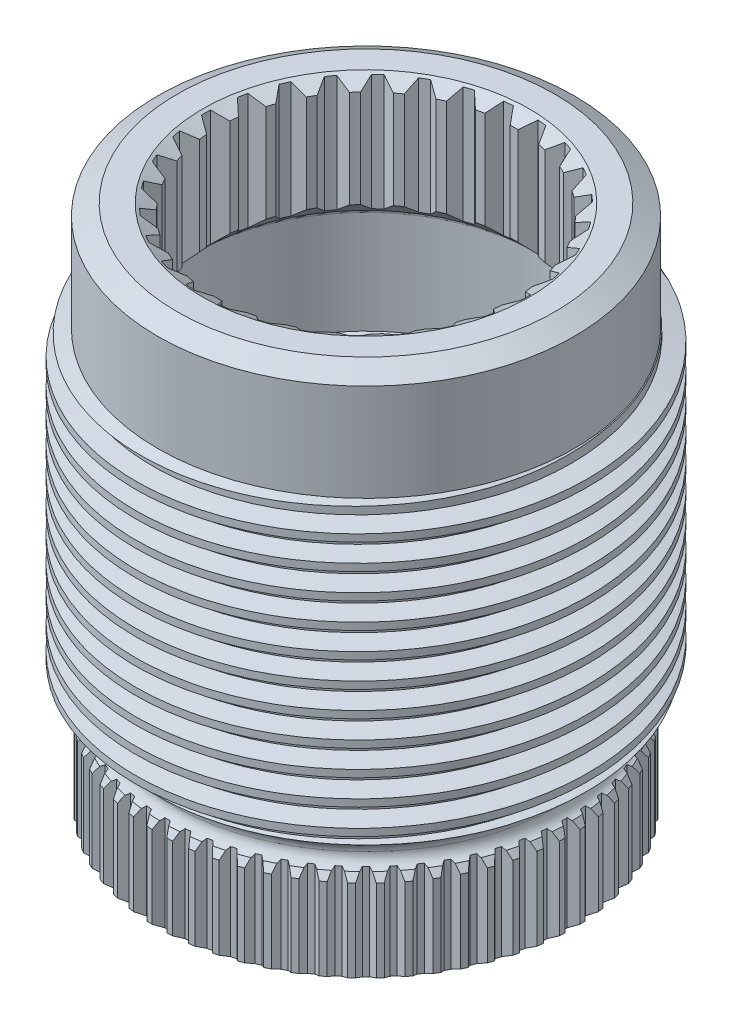
from build123d import *

# Parameters (mm, degrees)
SKETCH1_R           = 28.17114
BOSS_EXTRUDE1_DEPTH = 37.8714
SKETCH2_R           = 25.93975
BOSS_EXTRUDE2_DEPTH = 13.4874
CHAMFER1_SIZE       = 2.44475
CHAMFER1_SIZE2      = 1.411477071
SKETCH3_R           = 24.13
BOSS_EXTRUDE3_DEPTH = 3.048
SKETCH4_R           = 25.7302
BOSS_EXTRUDE4_DEPTH = 12.2682
CHAMFER2_SIZE       = 1.311023897
CHAMFER2_SIZE_2     = 2.27076
CHAMFER3_SIZE       = 2.2352
CHAMFER3_SIZE2      = 1.290493322
FILLET1_R           = 1.524
FILLET2_R           = 1.524
SKETCH8_R           = 18.4531
CUT_EXTRUDE1_DEPTH  = 66.675
SKETCH9_R           = 19.08175
CUT_EXTRUDE2_DEPTH  = 51.3334
SKETCH11_R          = 21.336
CUT_EXTRUDE3_DEPTH  = 13.5636
CHAMFER5_SIZE2      = 2.25425
CHAMFER5_SIZE       = 1.301491844
CHAMFER6_SIZE       = 1.8669
CHAMFER6_SIZE2      = 1.077855218
FILLET4_R           = 0.762
CHAMFER8_SIZE       = 1.74625
CHAMFER8_SIZE2      = 1.008197908
CHAMFER10_SIZE      = 2.1209
THREAD1_PITCH       = 3.175
THREAD3_PITCH       = 3.175
CUT_EXTRUDE4_DEPTH  = 21.844
CUT_EXTRUDE5_START  = -12.959881011
CUT_EXTRUDE5_DEPTH  = 12.959881011


with BuildPart() as part:
    # Sketch1 → Boss-Extrude1 (new body)
    with BuildSketch(Plane(origin=(0, 0, 0), x_dir=(1, 0, 0), z_dir=(0, 1, 0))):
        with Locations(Location((0, 0, 0), (0, 0, 270))):
            Circle(SKETCH1_R)
    extrude(amount=BOSS_EXTRUDE1_DEPTH)

    # Sketch2 → Boss-Extrude2 (add)
    with BuildSketch(Plane(origin=(0, 37.8714, 0), x_dir=(1, 0, 0), z_dir=(0, 1, 0))):
        with Locations(Location((0, 0, 0), (0, 0, 270))):
            Circle(SKETCH2_R)
    extrude(amount=BOSS_EXTRUDE2_DEPTH)

    # Chamfer1
    chamfer1_edges = [part.edges().sort_by_distance(p)[0] for p in [
        (0, 51.3588, -25.93975),
    ]]
    chamfer1_side = [part.faces().sort_by_distance(p)[0] for p in [
        (0, 51.3588, 0),
    ]]
    chamfer(chamfer1_edges, length=CHAMFER1_SIZE, length2=CHAMFER1_SIZE2, reference=chamfer1_side[0])

    # Sketch3 → Boss-Extrude3 (add)
    with BuildSketch(Plane.XZ):
        with Locations(Location((0, 0, 0), (0, 0, 90))):
            Circle(SKETCH3_R)
    extrude(amount=BOSS_EXTRUDE3_DEPTH)

    # Sketch4 → Boss-Extrude4 (add)
    with BuildSketch(Plane.XZ.offset(3.048)):
        with Locations(Location((0, 0, 0), (0, 0, 270))):
            Circle(SKETCH4_R)
    extrude(amount=BOSS_EXTRUDE4_DEPTH)

    # Chamfer2
    # the kernel refuses this chamfer: 2.27076, 1.311023897 mm, written as the material it takes off along each edge
    with BuildSketch(Plane(origin=(0, 37.8714, 0), x_dir=(0, 0, 1), z_dir=(-1, 0, 0))) as chamfer2_piece_1_section:
        Polygon((28.17114, -CHAMFER2_SIZE), (28.17114 - CHAMFER2_SIZE_2, 0), (28.17114, 0), align=None)
    chamfer2_piece_1 = revolve(axis=Axis((0, 37.8714, 0), (0, 1, 0)), mode=Mode.PRIVATE)
    chamfer2_piece_1 = chamfer2_piece_1 - Plane(origin=(0, 37.8714, 0), x_dir=(0, 0, 1), z_dir=(0, -1, 0)) * Cylinder(25.93975, 113, mode=Mode.PRIVATE)
    add(chamfer2_piece_1, mode=Mode.SUBTRACT)

    # Chamfer3
    chamfer3_edges = [part.edges().sort_by_distance(p)[0] for p in [
        (0, -15.3162, 25.7302),
    ]]
    chamfer3_side = [part.faces().sort_by_distance(p)[0] for p in [
        (0, -15.3162, 0),
    ]]
    chamfer(chamfer3_edges, length=CHAMFER3_SIZE, length2=CHAMFER3_SIZE2, reference=chamfer3_side[0])

    # Fillet1
    fillet1_edges = [part.edges().sort_by_distance(p)[0] for p in [
        (0, -3.048, -24.13),
    ]]
    fillet(fillet1_edges, radius=FILLET1_R)

    # Fillet2
    fillet2_edges = [part.edges().sort_by_distance(p)[0] for p in [
        (0, 0, -24.13),
    ]]
    fillet(fillet2_edges, radius=FILLET2_R - 0.0001)  # a hair under: the kernel refuses the full size

    # Chamfer4: read off the stored shape, not the designer's step
    # Chamfer4 outline → Chamfer4 (revolve, cut)
    with BuildSketch(Plane.XY):
        Polygon((25.654, -2.95893919), (25.140652632, -2.95893919), (25.7302, -3.795987051), (25.7302, -3.048), (25.654, -3.048), align=None)
    revolve(axis=Axis((0, 0, 0), (0, 1, 0)), mode=Mode.SUBTRACT)

    # Sketch8 → Cut-Extrude1 (cut)
    with BuildSketch(Plane(origin=(0, 51.3588, 0), x_dir=(1, 0, 0), z_dir=(0, 1, 0))):
        with Locations(Location((0, 0, 0), (0, 0, 270))):
            Circle(SKETCH8_R)
    extrude(amount=-CUT_EXTRUDE1_DEPTH, mode=Mode.SUBTRACT)

    # Sketch9 → Cut-Extrude2 (cut)
    with BuildSketch(Plane.XZ.offset(15.3162)):
        with Locations(Location((0, 0, 0), (0, 0, 270))):
            Circle(SKETCH9_R)
    extrude(amount=-CUT_EXTRUDE2_DEPTH, mode=Mode.SUBTRACT)

    # Sketch11 → Cut-Extrude3 (cut)
    with BuildSketch(Plane.XZ.offset(-36.0172)):
        with Locations(Location((0, 0, 0), (0, 0, 90))):
            Circle(SKETCH11_R)
    extrude(amount=CUT_EXTRUDE3_DEPTH, mode=Mode.SUBTRACT)

    # Chamfer5
    chamfer5_edges = [part.edges().sort_by_distance(p)[0] for p in [
        (0, 22.4536, 19.08175),
    ]]
    chamfer5_side = [part.faces().sort_by_distance(p)[0] for p in [
        (0, 22.427570163, 19.08175),
    ]]
    chamfer(chamfer5_edges, length=CHAMFER5_SIZE - 0.0001, length2=CHAMFER5_SIZE2 - 0.0001, reference=chamfer5_side[0])  # a hair under: the kernel refuses the full size

    # Chamfer6
    chamfer6_edges = [part.edges().sort_by_distance(p)[0] for p in [
        (0, 51.3588, -18.4531),
    ]]
    chamfer6_side = [part.faces().sort_by_distance(p)[0] for p in [
        (0, 51.3588, -22.830461047),
    ]]
    chamfer(chamfer6_edges, length=CHAMFER6_SIZE, length2=CHAMFER6_SIZE2, reference=chamfer6_side[0])

    # Fillet4
    fillet4_edges = [part.edges().sort_by_distance(p)[0] for p in [
        (0, 36.0172, -21.336),
    ]]
    fillet(fillet4_edges, radius=FILLET4_R)

    # Chamfer8
    chamfer8_edges = [part.edges().sort_by_distance(p)[0] for p in [
        (0, -15.3162, 19.08175),
    ]]
    chamfer8_side = [part.faces().sort_by_distance(p)[0] for p in [
        (0, -15.3162, 22.830461047),
    ]]
    chamfer(chamfer8_edges, length=CHAMFER8_SIZE, length2=CHAMFER8_SIZE2, reference=chamfer8_side[0])

    # Chamfer9: read off the stored shape, not the designer's step
    # Chamfer9 outline → Chamfer9 (revolve, cut)
    with BuildSketch(Plane.XY):
        Polygon((25.039915621, -0.129196654), (25.654, -0.129196654), (25.654, 0), (28.17114, 0), (28.17114, 2.026967556), align=None)
    revolve(axis=Axis((0, 0, 0), (0, 1, 0)), mode=Mode.SUBTRACT)

    # Chamfer10
    chamfer10_edges = [part.edges().sort_by_distance(p)[0] for p in [
        (0, 36.0172, -18.4531),
    ]]
    chamfer(chamfer10_edges, length=CHAMFER10_SIZE - 0.0001)  # a hair under: the kernel refuses the full size

    # Thread1: arcs per turn and ends read off the stored shape
    # Thread1: the profile of Thread Profile1 profile screwed along a right-hand helix through 12.716664 turns, 12 arcs to a turn; built about Z, then put on its axis
    thread1_z = Axis((0, 0, 0), (0, 0, 1))
    thread1_corners = [(28.17144, 0, -7.7585e-05), (28.17144, 0, 2.275431432), (26.0477, 0, 1.726194924), (26.0477, 0, 0.549158924)]
    with BuildLine(mode=Mode.PRIVATE) as thread1_profile:
        Line(thread1_corners[0], thread1_corners[1])
        Line(thread1_corners[1], thread1_corners[2])
        Line(thread1_corners[2], thread1_corners[3])
        Line(thread1_corners[3], thread1_corners[0])
    thread1_cap = Face(thread1_profile.wire())
    thread1_turn_angles = [0, 15, 30, 45, 60, 75, 90, 105, 120, 135, 150, 165, 180, 195, 210, 225, 240, 255, 270, 285, 300, 315, 330, 345, 360]
    thread1_turn_weights = [1, 0.9659258262890683, 1, 0.9659258262890683, 1, 0.9659258262890683, 1, 0.9659258262890683, 1, 0.9659258262890683, 1, 0.9659258262890683, 1, 0.9659258262890683, 1, 0.9659258262890683, 1, 0.9659258262890683, 1, 0.9659258262890683, 1, 0.9659258262890683, 1, 0.9659258262890683, 1]
    thread1_turn_rails = [Edge.make_bspline([Vector(p[0], p[1], 0).rotate(thread1_z, thread1_turn_angles[k]) / thread1_turn_weights[k] + Vector(0, 0, p[2] + THREAD1_PITCH * thread1_turn_angles[k] / 360) for k in range(25)], [0, 0, 0, 1, 1, 2, 2, 3, 3, 4, 4, 5, 5, 6, 6, 7, 7, 8, 8, 9, 9, 10, 10, 11, 11, 12, 12, 12], 2, thread1_turn_weights) for p in thread1_corners]
    thread1_turn_sides = [Face.make_surface_from_curves(thread1_turn_rails[p[0]], thread1_turn_rails[p[1]]) for p in [(0, 1), (1, 2), (2, 3), (3, 0)]]
    thread1_last_angles = [4320, 4335, 4350, 4365, 4380, 4395, 4410, 4425, 4440, 4455, 4470, 4485, 4500, 4515, 4530, 4545, 4560, 4568.9995, 4577.999]
    thread1_last_weights = [1, 0.9659258262890683, 1, 0.9659258262890683, 1, 0.9659258262890683, 1, 0.9659258262890683, 1, 0.9659258262890683, 1, 0.9659258262890683, 1, 0.9659258262890683, 1, 0.9659258262890683, 1, 0.9876897057057689, 1]
    thread1_last_rails = [Edge.make_bspline([Vector(p[0], p[1], 0).rotate(thread1_z, thread1_last_angles[k]) / thread1_last_weights[k] + Vector(0, 0, p[2] + THREAD1_PITCH * thread1_last_angles[k] / 360) for k in range(19)], [0, 0, 0, 1, 1, 2, 2, 3, 3, 4, 4, 5, 5, 6, 6, 7, 7, 8, 8, 9, 9, 9], 2, thread1_last_weights) for p in thread1_corners]
    thread1_last_sides = [Face.make_surface_from_curves(thread1_last_rails[p[0]], thread1_last_rails[p[1]]) for p in [(0, 1), (1, 2), (2, 3), (3, 0)]]
    thread1 = Plane(origin=(0, 39.862376103, 0), x_dir=(-1, 0, 0), z_dir=(0, -1, 0)) * Solid(Shell([*[p.moved(Location((0, 0, THREAD1_PITCH * i))) for i in range(12) for p in thread1_turn_sides], *thread1_last_sides, thread1_cap, thread1_cap.rotate(thread1_z, 4577.999).moved(Location((0, 0, THREAD1_PITCH * 4577.999 / 360)))]))
    add(thread1, mode=Mode.SUBTRACT)

    # Thread3: arcs per turn and ends read off the stored shape
    # Thread3: the profile of Thread Profile5 profile screwed along a right-hand helix through 11.483499 turns, 12 arcs to a turn; built about Z, then put on its axis
    thread3_z = Axis((0, 0, 0), (0, 0, 1))
    thread3_corners = [(19.08145, 0, -0.000173205), (21.14423, 0, 1.190773384), (21.14423, 0, 1.587013384), (19.08145, 0, 2.777959972)]
    with BuildLine(mode=Mode.PRIVATE) as thread3_profile:
        Line(thread3_corners[0], thread3_corners[1])
        Line(thread3_corners[1], thread3_corners[2])
        Line(thread3_corners[2], thread3_corners[3])
        Line(thread3_corners[3], thread3_corners[0])
    thread3_cap = Face(thread3_profile.wire())
    thread3_turn_angles = [0, 15, 30, 45, 60, 75, 90, 105, 120, 135, 150, 165, 180, 195, 210, 225, 240, 255, 270, 285, 300, 315, 330, 345, 360]
    thread3_turn_weights = [1, 0.9659258262890683, 1, 0.9659258262890683, 1, 0.9659258262890683, 1, 0.9659258262890683, 1, 0.9659258262890683, 1, 0.9659258262890683, 1, 0.9659258262890683, 1, 0.9659258262890683, 1, 0.9659258262890683, 1, 0.9659258262890683, 1, 0.9659258262890683, 1, 0.9659258262890683, 1]
    thread3_turn_rails = [Edge.make_bspline([Vector(p[0], p[1], 0).rotate(thread3_z, thread3_turn_angles[k]) / thread3_turn_weights[k] + Vector(0, 0, p[2] + THREAD3_PITCH * thread3_turn_angles[k] / 360) for k in range(25)], [0, 0, 0, 1, 1, 2, 2, 3, 3, 4, 4, 5, 5, 6, 6, 7, 7, 8, 8, 9, 9, 10, 10, 11, 11, 12, 12, 12], 2, thread3_turn_weights) for p in thread3_corners]
    thread3_turn_sides = [Face.make_surface_from_curves(thread3_turn_rails[p[0]], thread3_turn_rails[p[1]]) for p in [(0, 1), (1, 2), (2, 3), (3, 0)]]
    thread3_last_angles = [3960, 3975, 3990, 4005, 4020, 4035, 4050, 4065, 4080, 4095, 4110, 4122.029872334, 4134.059744667]
    thread3_last_weights = [1, 0.9659258262890683, 1, 0.9659258262890683, 1, 0.9659258262890683, 1, 0.9659258262890683, 1, 0.9659258262890683, 1, 0.9780390687569304, 1]
    thread3_last_rails = [Edge.make_bspline([Vector(p[0], p[1], 0).rotate(thread3_z, thread3_last_angles[k]) / thread3_last_weights[k] + Vector(0, 0, p[2] + THREAD3_PITCH * thread3_last_angles[k] / 360) for k in range(13)], [0, 0, 0, 1, 1, 2, 2, 3, 3, 4, 4, 5, 5, 6, 6, 6], 2, thread3_last_weights) for p in thread3_corners]
    thread3_last_sides = [Face.make_surface_from_curves(thread3_last_rails[p[0]], thread3_last_rails[p[1]]) for p in [(0, 1), (1, 2), (2, 3), (3, 0)]]
    thread3 = Plane(origin=(0, 22.152108156, 0), x_dir=(-1, 0, 0), z_dir=(0, -1, 0)) * Solid(Shell([*[p.moved(Location((0, 0, THREAD3_PITCH * i))) for i in range(11) for p in thread3_turn_sides], *thread3_last_sides, thread3_cap, thread3_cap.rotate(thread3_z, 4134.059744667).moved(Location((0, 0, THREAD3_PITCH * 4134.059744667 / 360)))]))
    add(thread3, mode=Mode.SUBTRACT)

    # Sketch12 → Cut-Extrude4 (cut)
    with BuildSketch(Plane(origin=(0, 51.3588, 0), x_dir=(1, 0, 0), z_dir=(0, 1, 0))):
        with BuildLine():
            Line((-19.931277354, 0.554891028), (-18.37006938, 1.456254871))
            ThreePointArc((-18.37006938, 1.456254871), (-18.4277, 0), (-18.37006938, -1.456254871))
            Line((-18.37006938, -1.456254871), (-19.931277354, -0.554891028))
            ThreePointArc((-19.931277354, -0.554891028), (-19.939, 0), (-19.931277354, 0.554891028))
        make_face()
        with BuildLine():
            Line((-19.611099455, 3.601180247), (-18.271411702, 2.394919977))
            ThreePointArc((-18.271411702, 2.394919977), (-18.025010542, 3.831334265), (-17.665866877, 5.243784394))
            Line((-17.665866877, 5.243784394), (-19.380362791, 4.686710902))
            ThreePointArc((-19.380362791, 4.686710902), (-19.503285011, 4.145551203), (-19.611099455, 3.601180247))
        make_face()
        with BuildLine():
            Line((-18.433822405, 7.599862665), (-17.374205657, 6.14142533))
            ThreePointArc((-17.374205657, 6.14142533), (-16.83454163, 7.495220838), (-16.189581221, 8.802135376))
            Line((-16.189581221, 8.802135376), (-17.982433378, 8.613699021))
            ThreePointArc((-17.982433378, 8.613699021), (-18.21518288, 8.109921926), (-18.433822405, 7.599862665))
        make_face()
        with BuildLine():
            Line((-16.450898861, 11.266394616), (-15.717663453, 9.619520926))
            ThreePointArc((-15.717663453, 9.619520926), (-14.908322467, 10.831530294), (-14.00573318, 11.975790804))
            Line((-14.00573318, 11.975790804), (-15.798585336, 12.164227159))
            ThreePointArc((-15.798585336, 12.164227159), (-16.130989851, 11.719850145), (-16.450898861, 11.266394616))
        make_face()
        with BuildLine():
            Line((-13.748992097, 14.440531061), (-13.374183935, 12.677197299))
            ThreePointArc((-13.374183935, 12.677197299), (-12.330538075, 13.6944499), (-11.209767391, 14.626046709))
            Line((-11.209767391, 14.626046709), (-12.924263305, 15.1831202))
            ThreePointArc((-12.924263305, 15.1831202), (-13.34179516, 14.817564675), (-13.748992097, 14.440531061))
        make_face()
        with BuildLine():
            Line((-10.446188403, 16.983547004), (-10.446188403, 15.180819317))
            ThreePointArc((-10.446188403, 15.180819317), (-9.21385, 15.958856333), (-7.923880977, 16.637074188))
            Line((-7.923880977, 16.637074188), (-9.485088951, 17.538438032))
            ThreePointArc((-9.485088951, 17.538438032), (-9.9695, 17.267680526), (-10.446188403, 16.983547004))
        make_face()
        with BuildLine():
            Line((-6.68683615, 18.784300448), (-7.061644311, 17.020966686))
            ThreePointArc((-7.061644311, 17.020966686), (-5.694472467, 17.525784165), (-4.291682942, 17.920981692))
            Line((-4.291682942, 17.920981692), (-5.631370694, 19.127241963))
            ThreePointArc((-5.631370694, 19.127241963), (-6.161489851, 18.963115878), (-6.68683615, 18.784300448))
        make_face()
        with BuildLine():
            Line((-2.635237069, 19.764089824), (-3.368472477, 18.117216134))
            ThreePointArc((-3.368472477, 18.117216134), (-1.926219163, 18.326751131), (-0.471917768, 18.421656302))
            Line((-0.471917768, 18.421656302), (-1.531534516, 19.880093637))
            ThreePointArc((-1.531534516, 19.880093637), (-2.084193029, 19.829772072), (-2.635237069, 19.764089824))
        make_face()
        with BuildLine():
            Line((1.531534516, 19.880093637), (0.471917768, 18.421656302))
            ThreePointArc((0.471917768, 18.421656302), (1.926219163, 18.326751131), (3.368472477, 18.117216134))
            Line((3.368472477, 18.117216134), (2.635237069, 19.764089824))
            ThreePointArc((2.635237069, 19.764089824), (2.084193029, 19.829772072), (1.531534516, 19.880093637))
        make_face()
        with BuildLine():
            Line((5.631370694, 19.127241963), (4.291682942, 17.920981692))
            ThreePointArc((4.291682942, 17.920981692), (5.694472467, 17.525784165), (7.061644311, 17.020966686))
            Line((7.061644311, 17.020966686), (6.68683615, 18.784300448))
            ThreePointArc((6.68683615, 18.784300448), (6.161489851, 18.963115878), (5.631370694, 19.127241963))
        make_face()
        with BuildLine():
            Line((9.485088951, 17.538438032), (7.923880977, 16.637074188))
            ThreePointArc((7.923880977, 16.637074188), (9.21385, 15.958856333), (10.446188403, 15.180819317))
            Line((10.446188403, 15.180819317), (10.446188403, 16.983547004))
            ThreePointArc((10.446188403, 16.983547004), (9.9695, 17.267680526), (9.485088951, 17.538438032))
        make_face()
        with BuildLine():
            Line((12.924263305, 15.1831202), (11.209767391, 14.626046709))
            ThreePointArc((11.209767391, 14.626046709), (12.330538075, 13.6944499), (13.374183935, 12.677197299))
            Line((13.374183935, 12.677197299), (13.748992097, 14.440531061))
            ThreePointArc((13.748992097, 14.440531061), (13.34179516, 14.817564675), (12.924263305, 15.1831202))
        make_face()
        with BuildLine():
            Line((15.798585336, 12.164227159), (14.00573318, 11.975790804))
            ThreePointArc((14.00573318, 11.975790804), (14.908322467, 10.831530294), (15.717663453, 9.619520926))
            Line((15.717663453, 9.619520926), (16.450898861, 11.266394616))
            ThreePointArc((16.450898861, 11.266394616), (16.130989851, 11.719850145), (15.798585336, 12.164227159))
        make_face()
        with BuildLine():
            Line((17.982433378, 8.613699021), (16.189581221, 8.802135376))
            ThreePointArc((16.189581221, 8.802135376), (16.83454163, 7.495220838), (17.374205657, 6.14142533))
            Line((17.374205657, 6.14142533), (18.433822405, 7.599862665))
            ThreePointArc((18.433822405, 7.599862665), (18.21518288, 8.109921926), (17.982433378, 8.613699021))
        make_face()
        with BuildLine():
            Line((19.380362791, 4.686710902), (17.665866877, 5.243784394))
            ThreePointArc((17.665866877, 5.243784394), (18.025010542, 3.831334265), (18.271411702, 2.394919977))
            Line((18.271411702, 2.394919977), (19.611099455, 3.601180247))
            ThreePointArc((19.611099455, 3.601180247), (19.503285011, 4.145551203), (19.380362791, 4.686710902))
        make_face()
        with BuildLine():
            Line((19.931277354, 0.554891028), (18.37006938, 1.456254871))
            ThreePointArc((18.37006938, 1.456254871), (18.4277, 0), (18.37006938, -1.456254871))
            Line((18.37006938, -1.456254871), (19.931277354, -0.554891028))
            ThreePointArc((19.931277354, -0.554891028), (19.939, 0), (19.931277354, 0.554891028))
        make_face()
        with BuildLine():
            Line((19.611099455, -3.601180247), (18.271411702, -2.394919977))
            ThreePointArc((18.271411702, -2.394919977), (18.025010542, -3.831334265), (17.665866877, -5.243784394))
            Line((17.665866877, -5.243784394), (19.380362791, -4.686710902))
            ThreePointArc((19.380362791, -4.686710902), (19.503285011, -4.145551203), (19.611099455, -3.601180247))
        make_face()
        with BuildLine():
            Line((18.433822405, -7.599862665), (17.374205657, -6.14142533))
            ThreePointArc((17.374205657, -6.14142533), (16.83454163, -7.495220838), (16.189581221, -8.802135376))
            Line((16.189581221, -8.802135376), (17.982433378, -8.613699021))
            ThreePointArc((17.982433378, -8.613699021), (18.21518288, -8.109921926), (18.433822405, -7.599862665))
        make_face()
        with BuildLine():
            Line((16.450898861, -11.266394616), (15.717663453, -9.619520926))
            ThreePointArc((15.717663453, -9.619520926), (14.908322467, -10.831530294), (14.00573318, -11.975790804))
            Line((14.00573318, -11.975790804), (15.798585336, -12.164227159))
            ThreePointArc((15.798585336, -12.164227159), (16.130989851, -11.719850145), (16.450898861, -11.266394616))
        make_face()
        with BuildLine():
            Line((13.748992097, -14.440531061), (13.374183935, -12.677197299))
            ThreePointArc((13.374183935, -12.677197299), (12.330538075, -13.6944499), (11.209767391, -14.626046709))
            Line((11.209767391, -14.626046709), (12.924263305, -15.1831202))
            ThreePointArc((12.924263305, -15.1831202), (13.34179516, -14.817564675), (13.748992097, -14.440531061))
        make_face()
        with BuildLine():
            Line((10.446188403, -16.983547004), (10.446188403, -15.180819317))
            ThreePointArc((10.446188403, -15.180819317), (9.21385, -15.958856333), (7.923880977, -16.637074188))
            Line((7.923880977, -16.637074188), (9.485088951, -17.538438032))
            ThreePointArc((9.485088951, -17.538438032), (9.9695, -17.267680526), (10.446188403, -16.983547004))
        make_face()
        with BuildLine():
            Line((6.68683615, -18.784300448), (7.061644311, -17.020966686))
            ThreePointArc((7.061644311, -17.020966686), (5.694472467, -17.525784165), (4.291682942, -17.920981692))
            Line((4.291682942, -17.920981692), (5.631370694, -19.127241963))
            ThreePointArc((5.631370694, -19.127241963), (6.161489851, -18.963115878), (6.68683615, -18.784300448))
        make_face()
        with BuildLine():
            Line((2.635237069, -19.764089824), (3.368472477, -18.117216134))
            ThreePointArc((3.368472477, -18.117216134), (1.926219163, -18.326751131), (0.471917768, -18.421656302))
            Line((0.471917768, -18.421656302), (1.531534516, -19.880093637))
            ThreePointArc((1.531534516, -19.880093637), (2.084193029, -19.829772072), (2.635237069, -19.764089824))
        make_face()
        with BuildLine():
            Line((-1.531534516, -19.880093637), (-0.471917768, -18.421656302))
            ThreePointArc((-0.471917768, -18.421656302), (-1.926219163, -18.326751131), (-3.368472477, -18.117216134))
            Line((-3.368472477, -18.117216134), (-2.635237069, -19.764089824))
            ThreePointArc((-2.635237069, -19.764089824), (-2.084193029, -19.829772072), (-1.531534516, -19.880093637))
        make_face()
        with BuildLine():
            Line((-5.631370694, -19.127241963), (-4.291682942, -17.920981692))
            ThreePointArc((-4.291682942, -17.920981692), (-5.694472467, -17.525784165), (-7.061644311, -17.020966686))
            Line((-7.061644311, -17.020966686), (-6.68683615, -18.784300448))
            ThreePointArc((-6.68683615, -18.784300448), (-6.161489851, -18.963115878), (-5.631370694, -19.127241963))
        make_face()
        with BuildLine():
            Line((-9.485088951, -17.538438032), (-7.923880977, -16.637074188))
            ThreePointArc((-7.923880977, -16.637074188), (-9.21385, -15.958856333), (-10.446188403, -15.180819317))
            Line((-10.446188403, -15.180819317), (-10.446188403, -16.983547004))
            ThreePointArc((-10.446188403, -16.983547004), (-9.9695, -17.267680526), (-9.485088951, -17.538438032))
        make_face()
        with BuildLine():
            Line((-12.924263305, -15.1831202), (-11.209767391, -14.626046709))
            ThreePointArc((-11.209767391, -14.626046709), (-12.330538075, -13.6944499), (-13.374183935, -12.677197299))
            Line((-13.374183935, -12.677197299), (-13.748992097, -14.440531061))
            ThreePointArc((-13.748992097, -14.440531061), (-13.34179516, -14.817564675), (-12.924263305, -15.1831202))
        make_face()
        with BuildLine():
            Line((-15.798585336, -12.164227159), (-14.00573318, -11.975790804))
            ThreePointArc((-14.00573318, -11.975790804), (-14.908322467, -10.831530294), (-15.717663453, -9.619520926))
            Line((-15.717663453, -9.619520926), (-16.450898861, -11.266394616))
            ThreePointArc((-16.450898861, -11.266394616), (-16.130989851, -11.719850145), (-15.798585336, -12.164227159))
        make_face()
        with BuildLine():
            Line((-17.982433378, -8.613699021), (-16.189581221, -8.802135376))
            ThreePointArc((-16.189581221, -8.802135376), (-16.83454163, -7.495220838), (-17.374205657, -6.14142533))
            Line((-17.374205657, -6.14142533), (-18.433822405, -7.599862665))
            ThreePointArc((-18.433822405, -7.599862665), (-18.21518288, -8.109921926), (-17.982433378, -8.613699021))
        make_face()
        with BuildLine():
            Line((-19.380362791, -4.686710902), (-17.665866877, -5.243784394))
            ThreePointArc((-17.665866877, -5.243784394), (-18.025010542, -3.831334265), (-18.271411702, -2.394919977))
            Line((-18.271411702, -2.394919977), (-19.611099455, -3.601180247))
            ThreePointArc((-19.611099455, -3.601180247), (-19.503285011, -4.145551203), (-19.380362791, -4.686710902))
        make_face()
    extrude(amount=-CUT_EXTRUDE4_DEPTH, mode=Mode.SUBTRACT)

    # Sketch13 → Cut-Extrude5 (cut)
    with BuildSketch(Plane.XZ.offset(15.3162).offset(CUT_EXTRUDE5_START)):
        with BuildLine():
            Line((-25.714203873, 0.907144543), (-24.714017816, 0.329686854))
            ThreePointArc((-24.714017816, 0.329686854), (-24.716216742, 0), (-24.714017816, -0.329686854))
            Line((-24.714017816, -0.329686854), (-25.714203873, -0.907144543))
            ThreePointArc((-25.714203873, -0.907144543), (-25.7302, 0), (-25.714203873, 0.907144543))
        make_face()
        with BuildLine():
            Line((-25.679298667, 1.617656335), (-24.627328028, 2.094298031))
            ThreePointArc((-24.627328028, 2.094298031), (-24.597201403, 2.422612885), (-24.562698103, 2.750496674))
            Line((-24.562698103, 2.750496674), (-25.501467239, 3.423209124))
            ThreePointArc((-25.501467239, 3.423209124), (-25.606302054, 2.522000624), (-25.679298667, 1.617656335))
        make_face()
        with BuildLine():
            Line((-25.397087777, 4.126878299), (-24.303463608, 4.49811368))
            ThreePointArc((-24.303463608, 4.49811368), (-24.241301568, 4.821894683), (-24.174826179, 5.144817708))
            Line((-24.174826179, 5.144817708), (-25.043137535, 5.906306329))
            ThreePointArc((-25.043137535, 5.906306329), (-25.235801422, 5.019713004), (-25.397087777, 4.126878299))
        make_face()
        with BuildLine():
            Line((-24.870289048, 6.596356168), (-23.745543548, 6.858610037))
            ThreePointArc((-23.745543548, 6.858610037), (-23.651944747, 7.174739), (-23.554137464, 7.489591334))
            Line((-23.554137464, 7.489591334), (-24.343628726, 8.332522576))
            ThreePointArc((-24.343628726, 8.332522576), (-24.622266226, 7.469082803), (-24.870289048, 6.596356168))
        make_face()
        with BuildLine():
            Line((-24.10397584, 9.002307522), (-22.958940923, 9.153054229))
            ThreePointArc((-22.958940923, 9.153054229), (-22.834806769, 9.458486658), (-22.706609529, 9.762236102))
            Line((-22.706609529, 9.762236102), (-23.409677466, 10.678492075))
            ThreePointArc((-23.409677466, 10.678492075), (-23.771605147, 9.846521251), (-24.10397584, 9.002307522))
        make_face()
        with BuildLine():
            Line((-23.105528169, 11.321561733), (-21.951231147, 11.359349505))
            ThreePointArc((-21.951231147, 11.359349505), (-21.797757119, 11.651143919), (-21.640404532, 11.9408652))
            Line((-21.640404532, 11.9408652), (-22.250278214, 12.921621858))
            ThreePointArc((-22.250278214, 12.921621858), (-22.692010516, 12.129132318), (-23.105528169, 11.321561733))
        make_face()
        with BuildLine():
            Line((-21.88456163, 13.531783116), (-20.732119014, 13.456248036))
            ThreePointArc((-20.732119014, 13.456248036), (-20.550783152, 13.731594295), (-20.36579061, 14.004497238))
            Line((-20.36579061, 14.004497238), (-20.87659662, 15.040309359))
            ThreePointArc((-20.87659662, 15.040309359), (-21.393879418, 14.29493321), (-21.88456163, 13.531783116))
        make_face()
        with BuildLine():
            Line((-20.4528348, 15.61168603), (-19.313345243, 15.423555543))
            ThreePointArc((-19.313345243, 15.423555543), (-19.105893909, 15.679801911), (-18.89504299, 15.933258312))
            Line((-18.89504299, 15.933258312), (-19.301861988, 17.014150459))
            ThreePointArc((-19.301861988, 17.014150459), (-19.889713567, 16.32306608), (-20.4528348, 15.61168603))
        make_face()
        with BuildLine():
            Line((-18.824135989, 17.541239873), (-17.708573398, 17.242325778))
            ThreePointArc((-17.708573398, 17.242325778), (-17.477004464, 17.477004464), (-17.242325778, 17.708573398))
            Line((-17.242325778, 17.708573398), (-17.541239873, 18.824135989))
            ThreePointArc((-17.541239873, 18.824135989), (-18.193998901, 18.193998901), (-18.824135989, 17.541239873))
        make_face()
        with BuildLine():
            Line((-17.014150459, 19.301861988), (-15.933258312, 18.89504299))
            ThreePointArc((-15.933258312, 18.89504299), (-15.679801911, 19.105893909), (-15.423555543, 19.313345243))
            Line((-15.423555543, 19.313345243), (-15.61168603, 20.4528348))
            ThreePointArc((-15.61168603, 20.4528348), (-16.32306608, 19.889713567), (-17.014150459, 19.301861988))
        make_face()
        with BuildLine():
            Line((-15.040309359, 20.87659662), (-14.004497238, 20.36579061))
            ThreePointArc((-14.004497238, 20.36579061), (-13.731594295, 20.550783152), (-13.456248036, 20.732119014))
            Line((-13.456248036, 20.732119014), (-13.531783116, 21.88456163))
            ThreePointArc((-13.531783116, 21.88456163), (-14.29493321, 21.393879418), (-15.040309359, 20.87659662))
        make_face()
        with BuildLine():
            Line((-12.921621858, 22.250278214), (-11.9408652, 21.640404532))
            ThreePointArc((-11.9408652, 21.640404532), (-11.651143919, 21.797757119), (-11.359349505, 21.951231147))
            Line((-11.359349505, 21.951231147), (-11.321561733, 23.105528169))
            ThreePointArc((-11.321561733, 23.105528169), (-12.129132318, 22.692010516), (-12.921621858, 22.250278214))
        make_face()
        with BuildLine():
            Line((-10.678492075, 23.409677466), (-9.762236102, 22.706609529))
            ThreePointArc((-9.762236102, 22.706609529), (-9.458486658, 22.834806769), (-9.153054229, 22.958940923))
            Line((-9.153054229, 22.958940923), (-9.002307522, 24.10397584))
            ThreePointArc((-9.002307522, 24.10397584), (-9.846521251, 23.771605147), (-10.678492075, 23.409677466))
        make_face()
        with BuildLine():
            Line((-8.332522576, 24.343628726), (-7.489591334, 23.554137464))
            ThreePointArc((-7.489591334, 23.554137464), (-7.174739, 23.651944747), (-6.858610037, 23.745543548))
            Line((-6.858610037, 23.745543548), (-6.596356168, 24.870289048))
            ThreePointArc((-6.596356168, 24.870289048), (-7.469082803, 24.622266226), (-8.332522576, 24.343628726))
        make_face()
        with BuildLine():
            Line((-5.906306329, 25.043137535), (-5.144817708, 24.174826179))
            ThreePointArc((-5.144817708, 24.174826179), (-4.821894683, 24.241301568), (-4.49811368, 24.303463608))
            Line((-4.49811368, 24.303463608), (-4.126878299, 25.397087777))
            ThreePointArc((-4.126878299, 25.397087777), (-5.019713004, 25.235801422), (-5.906306329, 25.043137535))
        make_face()
        with BuildLine():
            Line((-3.423209124, 25.501467239), (-2.750496674, 24.562698103))
            ThreePointArc((-2.750496674, 24.562698103), (-2.422612885, 24.597201403), (-2.094298031, 24.627328028))
            Line((-2.094298031, 24.627328028), (-1.617656335, 25.679298667))
            ThreePointArc((-1.617656335, 25.679298667), (-2.522000624, 25.606302054), (-3.423209124, 25.501467239))
        make_face()
        with BuildLine():
            Line((-0.907144543, 25.714203873), (-0.329686854, 24.714017816))
            ThreePointArc((-0.329686854, 24.714017816), (0, 24.716216742), (0.329686854, 24.714017816))
            Line((0.329686854, 24.714017816), (0.907144543, 25.714203873))
            ThreePointArc((0.907144543, 25.714203873), (0, 25.7302), (-0.907144543, 25.714203873))
        make_face()
        with BuildLine():
            Line((1.617656335, 25.679298667), (2.094298031, 24.627328028))
            ThreePointArc((2.094298031, 24.627328028), (2.422612885, 24.597201403), (2.750496674, 24.562698103))
            Line((2.750496674, 24.562698103), (3.423209124, 25.501467239))
            ThreePointArc((3.423209124, 25.501467239), (2.522000624, 25.606302054), (1.617656335, 25.679298667))
        make_face()
        with BuildLine():
            Line((4.126878299, 25.397087777), (4.49811368, 24.303463608))
            ThreePointArc((4.49811368, 24.303463608), (4.821894683, 24.241301568), (5.144817708, 24.174826179))
            Line((5.144817708, 24.174826179), (5.906306329, 25.043137535))
            ThreePointArc((5.906306329, 25.043137535), (5.019713004, 25.235801422), (4.126878299, 25.397087777))
        make_face()
        with BuildLine():
            Line((6.596356168, 24.870289048), (6.858610037, 23.745543548))
            ThreePointArc((6.858610037, 23.745543548), (7.174739, 23.651944747), (7.489591334, 23.554137464))
            Line((7.489591334, 23.554137464), (8.332522576, 24.343628726))
            ThreePointArc((8.332522576, 24.343628726), (7.469082803, 24.622266226), (6.596356168, 24.870289048))
        make_face()
        with BuildLine():
            Line((9.002307522, 24.10397584), (9.153054229, 22.958940923))
            ThreePointArc((9.153054229, 22.958940923), (9.458486658, 22.834806769), (9.762236102, 22.706609529))
            Line((9.762236102, 22.706609529), (10.678492075, 23.409677466))
            ThreePointArc((10.678492075, 23.409677466), (9.846521251, 23.771605147), (9.002307522, 24.10397584))
        make_face()
        with BuildLine():
            Line((11.321561733, 23.105528169), (11.359349505, 21.951231147))
            ThreePointArc((11.359349505, 21.951231147), (11.651143919, 21.797757119), (11.9408652, 21.640404532))
            Line((11.9408652, 21.640404532), (12.921621858, 22.250278214))
            ThreePointArc((12.921621858, 22.250278214), (12.129132318, 22.692010516), (11.321561733, 23.105528169))
        make_face()
        with BuildLine():
            Line((13.531783116, 21.88456163), (13.456248036, 20.732119014))
            ThreePointArc((13.456248036, 20.732119014), (13.731594295, 20.550783152), (14.004497238, 20.36579061))
            Line((14.004497238, 20.36579061), (15.040309359, 20.87659662))
            ThreePointArc((15.040309359, 20.87659662), (14.29493321, 21.393879418), (13.531783116, 21.88456163))
        make_face()
        with BuildLine():
            Line((15.61168603, 20.4528348), (15.423555543, 19.313345243))
            ThreePointArc((15.423555543, 19.313345243), (15.679801911, 19.105893909), (15.933258312, 18.89504299))
            Line((15.933258312, 18.89504299), (17.014150459, 19.301861988))
            ThreePointArc((17.014150459, 19.301861988), (16.32306608, 19.889713567), (15.61168603, 20.4528348))
        make_face()
        with BuildLine():
            Line((17.541239873, 18.824135989), (17.242325778, 17.708573398))
            ThreePointArc((17.242325778, 17.708573398), (17.477004464, 17.477004464), (17.708573398, 17.242325778))
            Line((17.708573398, 17.242325778), (18.824135989, 17.541239873))
            ThreePointArc((18.824135989, 17.541239873), (18.193998901, 18.193998901), (17.541239873, 18.824135989))
        make_face()
        with BuildLine():
            Line((19.301861988, 17.014150459), (18.89504299, 15.933258312))
            ThreePointArc((18.89504299, 15.933258312), (19.105893909, 15.679801911), (19.313345243, 15.423555543))
            Line((19.313345243, 15.423555543), (20.4528348, 15.61168603))
            ThreePointArc((20.4528348, 15.61168603), (19.889713567, 16.32306608), (19.301861988, 17.014150459))
        make_face()
        with BuildLine():
            Line((20.87659662, 15.040309359), (20.36579061, 14.004497238))
            ThreePointArc((20.36579061, 14.004497238), (20.550783152, 13.731594295), (20.732119014, 13.456248036))
            Line((20.732119014, 13.456248036), (21.88456163, 13.531783116))
            ThreePointArc((21.88456163, 13.531783116), (21.393879418, 14.29493321), (20.87659662, 15.040309359))
        make_face()
        with BuildLine():
            Line((22.250278214, 12.921621858), (21.640404532, 11.9408652))
            ThreePointArc((21.640404532, 11.9408652), (21.797757119, 11.651143919), (21.951231147, 11.359349505))
            Line((21.951231147, 11.359349505), (23.105528169, 11.321561733))
            ThreePointArc((23.105528169, 11.321561733), (22.692010516, 12.129132318), (22.250278214, 12.921621858))
        make_face()
        with BuildLine():
            Line((23.409677466, 10.678492075), (22.706609529, 9.762236102))
            ThreePointArc((22.706609529, 9.762236102), (22.834806769, 9.458486658), (22.958940923, 9.153054229))
            Line((22.958940923, 9.153054229), (24.10397584, 9.002307522))
            ThreePointArc((24.10397584, 9.002307522), (23.771605147, 9.846521251), (23.409677466, 10.678492075))
        make_face()
        with BuildLine():
            Line((24.343628726, 8.332522576), (23.554137464, 7.489591334))
            ThreePointArc((23.554137464, 7.489591334), (23.651944747, 7.174739), (23.745543548, 6.858610037))
            Line((23.745543548, 6.858610037), (24.870289048, 6.596356168))
            ThreePointArc((24.870289048, 6.596356168), (24.622266226, 7.469082803), (24.343628726, 8.332522576))
        make_face()
        with BuildLine():
            Line((25.043137535, 5.906306329), (24.174826179, 5.144817708))
            ThreePointArc((24.174826179, 5.144817708), (24.241301568, 4.821894683), (24.303463608, 4.49811368))
            Line((24.303463608, 4.49811368), (25.397087777, 4.126878299))
            ThreePointArc((25.397087777, 4.126878299), (25.235801422, 5.019713004), (25.043137535, 5.906306329))
        make_face()
        with BuildLine():
            Line((25.501467239, 3.423209124), (24.562698103, 2.750496674))
            ThreePointArc((24.562698103, 2.750496674), (24.597201403, 2.422612885), (24.627328028, 2.094298031))
            Line((24.627328028, 2.094298031), (25.679298667, 1.617656335))
            ThreePointArc((25.679298667, 1.617656335), (25.606302054, 2.522000624), (25.501467239, 3.423209124))
        make_face()
        with BuildLine():
            Line((25.714203873, 0.907144543), (24.714017816, 0.329686854))
            ThreePointArc((24.714017816, 0.329686854), (24.716216742, 0), (24.714017816, -0.329686854))
            Line((24.714017816, -0.329686854), (25.714203873, -0.907144543))
            ThreePointArc((25.714203873, -0.907144543), (25.7302, 0), (25.714203873, 0.907144543))
        make_face()
        with BuildLine():
            Line((25.679298667, -1.617656335), (24.627328028, -2.094298031))
            ThreePointArc((24.627328028, -2.094298031), (24.597201403, -2.422612885), (24.562698103, -2.750496674))
            Line((24.562698103, -2.750496674), (25.501467239, -3.423209124))
            ThreePointArc((25.501467239, -3.423209124), (25.606302054, -2.522000624), (25.679298667, -1.617656335))
        make_face()
        with BuildLine():
            Line((25.397087777, -4.126878299), (24.303463608, -4.49811368))
            ThreePointArc((24.303463608, -4.49811368), (24.241301568, -4.821894683), (24.174826179, -5.144817708))
            Line((24.174826179, -5.144817708), (25.043137535, -5.906306329))
            ThreePointArc((25.043137535, -5.906306329), (25.235801422, -5.019713004), (25.397087777, -4.126878299))
        make_face()
        with BuildLine():
            Line((24.870289048, -6.596356168), (23.745543548, -6.858610037))
            ThreePointArc((23.745543548, -6.858610037), (23.651944747, -7.174739), (23.554137464, -7.489591334))
            Line((23.554137464, -7.489591334), (24.343628726, -8.332522576))
            ThreePointArc((24.343628726, -8.332522576), (24.622266226, -7.469082803), (24.870289048, -6.596356168))
        make_face()
        with BuildLine():
            Line((24.10397584, -9.002307522), (22.958940923, -9.153054229))
            ThreePointArc((22.958940923, -9.153054229), (22.834806769, -9.458486658), (22.706609529, -9.762236102))
            Line((22.706609529, -9.762236102), (23.409677466, -10.678492075))
            ThreePointArc((23.409677466, -10.678492075), (23.771605147, -9.846521251), (24.10397584, -9.002307522))
        make_face()
        with BuildLine():
            Line((23.105528169, -11.321561733), (21.951231147, -11.359349505))
            ThreePointArc((21.951231147, -11.359349505), (21.797757119, -11.651143919), (21.640404532, -11.9408652))
            Line((21.640404532, -11.9408652), (22.250278214, -12.921621858))
            ThreePointArc((22.250278214, -12.921621858), (22.692010516, -12.129132318), (23.105528169, -11.321561733))
        make_face()
        with BuildLine():
            Line((21.88456163, -13.531783116), (20.732119014, -13.456248036))
            ThreePointArc((20.732119014, -13.456248036), (20.550783152, -13.731594295), (20.36579061, -14.004497238))
            Line((20.36579061, -14.004497238), (20.87659662, -15.040309359))
            ThreePointArc((20.87659662, -15.040309359), (21.393879418, -14.29493321), (21.88456163, -13.531783116))
        make_face()
        with BuildLine():
            Line((20.4528348, -15.61168603), (19.313345243, -15.423555543))
            ThreePointArc((19.313345243, -15.423555543), (19.105893909, -15.679801911), (18.89504299, -15.933258312))
            Line((18.89504299, -15.933258312), (19.301861988, -17.014150459))
            ThreePointArc((19.301861988, -17.014150459), (19.889713567, -16.32306608), (20.4528348, -15.61168603))
        make_face()
        with BuildLine():
            Line((18.824135989, -17.541239873), (17.708573398, -17.242325778))
            ThreePointArc((17.708573398, -17.242325778), (17.477004464, -17.477004464), (17.242325778, -17.708573398))
            Line((17.242325778, -17.708573398), (17.541239873, -18.824135989))
            ThreePointArc((17.541239873, -18.824135989), (18.193998901, -18.193998901), (18.824135989, -17.541239873))
        make_face()
        with BuildLine():
            Line((17.014150459, -19.301861988), (15.933258312, -18.89504299))
            ThreePointArc((15.933258312, -18.89504299), (15.679801911, -19.105893909), (15.423555543, -19.313345243))
            Line((15.423555543, -19.313345243), (15.61168603, -20.4528348))
            ThreePointArc((15.61168603, -20.4528348), (16.32306608, -19.889713567), (17.014150459, -19.301861988))
        make_face()
        with BuildLine():
            Line((15.040309359, -20.87659662), (14.004497238, -20.36579061))
            ThreePointArc((14.004497238, -20.36579061), (13.731594295, -20.550783152), (13.456248036, -20.732119014))
            Line((13.456248036, -20.732119014), (13.531783116, -21.88456163))
            ThreePointArc((13.531783116, -21.88456163), (14.29493321, -21.393879418), (15.040309359, -20.87659662))
        make_face()
        with BuildLine():
            Line((12.921621858, -22.250278214), (11.9408652, -21.640404532))
            ThreePointArc((11.9408652, -21.640404532), (11.651143919, -21.797757119), (11.359349505, -21.951231147))
            Line((11.359349505, -21.951231147), (11.321561733, -23.105528169))
            ThreePointArc((11.321561733, -23.105528169), (12.129132318, -22.692010516), (12.921621858, -22.250278214))
        make_face()
        with BuildLine():
            Line((10.678492075, -23.409677466), (9.762236102, -22.706609529))
            ThreePointArc((9.762236102, -22.706609529), (9.458486658, -22.834806769), (9.153054229, -22.958940923))
            Line((9.153054229, -22.958940923), (9.002307522, -24.10397584))
            ThreePointArc((9.002307522, -24.10397584), (9.846521251, -23.771605147), (10.678492075, -23.409677466))
        make_face()
        with BuildLine():
            Line((8.332522576, -24.343628726), (7.489591334, -23.554137464))
            ThreePointArc((7.489591334, -23.554137464), (7.174739, -23.651944747), (6.858610037, -23.745543548))
            Line((6.858610037, -23.745543548), (6.596356168, -24.870289048))
            ThreePointArc((6.596356168, -24.870289048), (7.469082803, -24.622266226), (8.332522576, -24.343628726))
        make_face()
        with BuildLine():
            Line((5.906306329, -25.043137535), (5.144817708, -24.174826179))
            ThreePointArc((5.144817708, -24.174826179), (4.821894683, -24.241301568), (4.49811368, -24.303463608))
            Line((4.49811368, -24.303463608), (4.126878299, -25.397087777))
            ThreePointArc((4.126878299, -25.397087777), (5.019713004, -25.235801422), (5.906306329, -25.043137535))
        make_face()
        with BuildLine():
            Line((3.423209124, -25.501467239), (2.750496674, -24.562698103))
            ThreePointArc((2.750496674, -24.562698103), (2.422612885, -24.597201403), (2.094298031, -24.627328028))
            Line((2.094298031, -24.627328028), (1.617656335, -25.679298667))
            ThreePointArc((1.617656335, -25.679298667), (2.522000624, -25.606302054), (3.423209124, -25.501467239))
        make_face()
        with BuildLine():
            Line((0.907144543, -25.714203873), (0.329686854, -24.714017816))
            ThreePointArc((0.329686854, -24.714017816), (0, -24.716216742), (-0.329686854, -24.714017816))
            Line((-0.329686854, -24.714017816), (-0.907144543, -25.714203873))
            ThreePointArc((-0.907144543, -25.714203873), (0, -25.7302), (0.907144543, -25.714203873))
        make_face()
        with BuildLine():
            Line((-1.617656335, -25.679298667), (-2.094298031, -24.627328028))
            ThreePointArc((-2.094298031, -24.627328028), (-2.422612885, -24.597201403), (-2.750496674, -24.562698103))
            Line((-2.750496674, -24.562698103), (-3.423209124, -25.501467239))
            ThreePointArc((-3.423209124, -25.501467239), (-2.522000624, -25.606302054), (-1.617656335, -25.679298667))
        make_face()
        with BuildLine():
            Line((-4.126878299, -25.397087777), (-4.49811368, -24.303463608))
            ThreePointArc((-4.49811368, -24.303463608), (-4.821894683, -24.241301568), (-5.144817708, -24.174826179))
            Line((-5.144817708, -24.174826179), (-5.906306329, -25.043137535))
            ThreePointArc((-5.906306329, -25.043137535), (-5.019713004, -25.235801422), (-4.126878299, -25.397087777))
        make_face()
        with BuildLine():
            Line((-6.596356168, -24.870289048), (-6.858610037, -23.745543548))
            ThreePointArc((-6.858610037, -23.745543548), (-7.174739, -23.651944747), (-7.489591334, -23.554137464))
            Line((-7.489591334, -23.554137464), (-8.332522576, -24.343628726))
            ThreePointArc((-8.332522576, -24.343628726), (-7.469082803, -24.622266226), (-6.596356168, -24.870289048))
        make_face()
        with BuildLine():
            Line((-9.002307522, -24.10397584), (-9.153054229, -22.958940923))
            ThreePointArc((-9.153054229, -22.958940923), (-9.458486658, -22.834806769), (-9.762236102, -22.706609529))
            Line((-9.762236102, -22.706609529), (-10.678492075, -23.409677466))
            ThreePointArc((-10.678492075, -23.409677466), (-9.846521251, -23.771605147), (-9.002307522, -24.10397584))
        make_face()
        with BuildLine():
            Line((-11.321561733, -23.105528169), (-11.359349505, -21.951231147))
            ThreePointArc((-11.359349505, -21.951231147), (-11.651143919, -21.797757119), (-11.9408652, -21.640404532))
            Line((-11.9408652, -21.640404532), (-12.921621858, -22.250278214))
            ThreePointArc((-12.921621858, -22.250278214), (-12.129132318, -22.692010516), (-11.321561733, -23.105528169))
        make_face()
        with BuildLine():
            Line((-13.531783116, -21.88456163), (-13.456248036, -20.732119014))
            ThreePointArc((-13.456248036, -20.732119014), (-13.731594295, -20.550783152), (-14.004497238, -20.36579061))
            Line((-14.004497238, -20.36579061), (-15.040309359, -20.87659662))
            ThreePointArc((-15.040309359, -20.87659662), (-14.29493321, -21.393879418), (-13.531783116, -21.88456163))
        make_face()
        with BuildLine():
            Line((-15.61168603, -20.4528348), (-15.423555543, -19.313345243))
            ThreePointArc((-15.423555543, -19.313345243), (-15.679801911, -19.105893909), (-15.933258312, -18.89504299))
            Line((-15.933258312, -18.89504299), (-17.014150459, -19.301861988))
            ThreePointArc((-17.014150459, -19.301861988), (-16.32306608, -19.889713567), (-15.61168603, -20.4528348))
        make_face()
        with BuildLine():
            Line((-17.541239873, -18.824135989), (-17.242325778, -17.708573398))
            ThreePointArc((-17.242325778, -17.708573398), (-17.477004464, -17.477004464), (-17.708573398, -17.242325778))
            Line((-17.708573398, -17.242325778), (-18.824135989, -17.541239873))
            ThreePointArc((-18.824135989, -17.541239873), (-18.193998901, -18.193998901), (-17.541239873, -18.824135989))
        make_face()
        with BuildLine():
            Line((-19.301861988, -17.014150459), (-18.89504299, -15.933258312))
            ThreePointArc((-18.89504299, -15.933258312), (-19.105893909, -15.679801911), (-19.313345243, -15.423555543))
            Line((-19.313345243, -15.423555543), (-20.4528348, -15.61168603))
            ThreePointArc((-20.4528348, -15.61168603), (-19.889713567, -16.32306608), (-19.301861988, -17.014150459))
        make_face()
        with BuildLine():
            Line((-20.87659662, -15.040309359), (-20.36579061, -14.004497238))
            ThreePointArc((-20.36579061, -14.004497238), (-20.550783152, -13.731594295), (-20.732119014, -13.456248036))
            Line((-20.732119014, -13.456248036), (-21.88456163, -13.531783116))
            ThreePointArc((-21.88456163, -13.531783116), (-21.393879418, -14.29493321), (-20.87659662, -15.040309359))
        make_face()
        with BuildLine():
            Line((-22.250278214, -12.921621858), (-21.640404532, -11.9408652))
            ThreePointArc((-21.640404532, -11.9408652), (-21.797757119, -11.651143919), (-21.951231147, -11.359349505))
            Line((-21.951231147, -11.359349505), (-23.105528169, -11.321561733))
            ThreePointArc((-23.105528169, -11.321561733), (-22.692010516, -12.129132318), (-22.250278214, -12.921621858))
        make_face()
        with BuildLine():
            Line((-23.409677466, -10.678492075), (-22.706609529, -9.762236102))
            ThreePointArc((-22.706609529, -9.762236102), (-22.834806769, -9.458486658), (-22.958940923, -9.153054229))
            Line((-22.958940923, -9.153054229), (-24.10397584, -9.002307522))
            ThreePointArc((-24.10397584, -9.002307522), (-23.771605147, -9.846521251), (-23.409677466, -10.678492075))
        make_face()
        with BuildLine():
            Line((-24.343628726, -8.332522576), (-23.554137464, -7.489591334))
            ThreePointArc((-23.554137464, -7.489591334), (-23.651944747, -7.174739), (-23.745543548, -6.858610037))
            Line((-23.745543548, -6.858610037), (-24.870289048, -6.596356168))
            ThreePointArc((-24.870289048, -6.596356168), (-24.622266226, -7.469082803), (-24.343628726, -8.332522576))
        make_face()
        with BuildLine():
            Line((-25.043137535, -5.906306329), (-24.174826179, -5.144817708))
            ThreePointArc((-24.174826179, -5.144817708), (-24.241301568, -4.821894683), (-24.303463608, -4.49811368))
            Line((-24.303463608, -4.49811368), (-25.397087777, -4.126878299))
            ThreePointArc((-25.397087777, -4.126878299), (-25.235801422, -5.019713004), (-25.043137535, -5.906306329))
        make_face()
        with BuildLine():
            Line((-25.501467239, -3.423209124), (-24.562698103, -2.750496674))
            ThreePointArc((-24.562698103, -2.750496674), (-24.597201403, -2.422612885), (-24.627328028, -2.094298031))
            Line((-24.627328028, -2.094298031), (-25.679298667, -1.617656335))
            ThreePointArc((-25.679298667, -1.617656335), (-25.606302054, -2.522000624), (-25.501467239, -3.423209124))
        make_face()
    extrude(amount=CUT_EXTRUDE5_DEPTH, mode=Mode.SUBTRACT)


solid = part.part
